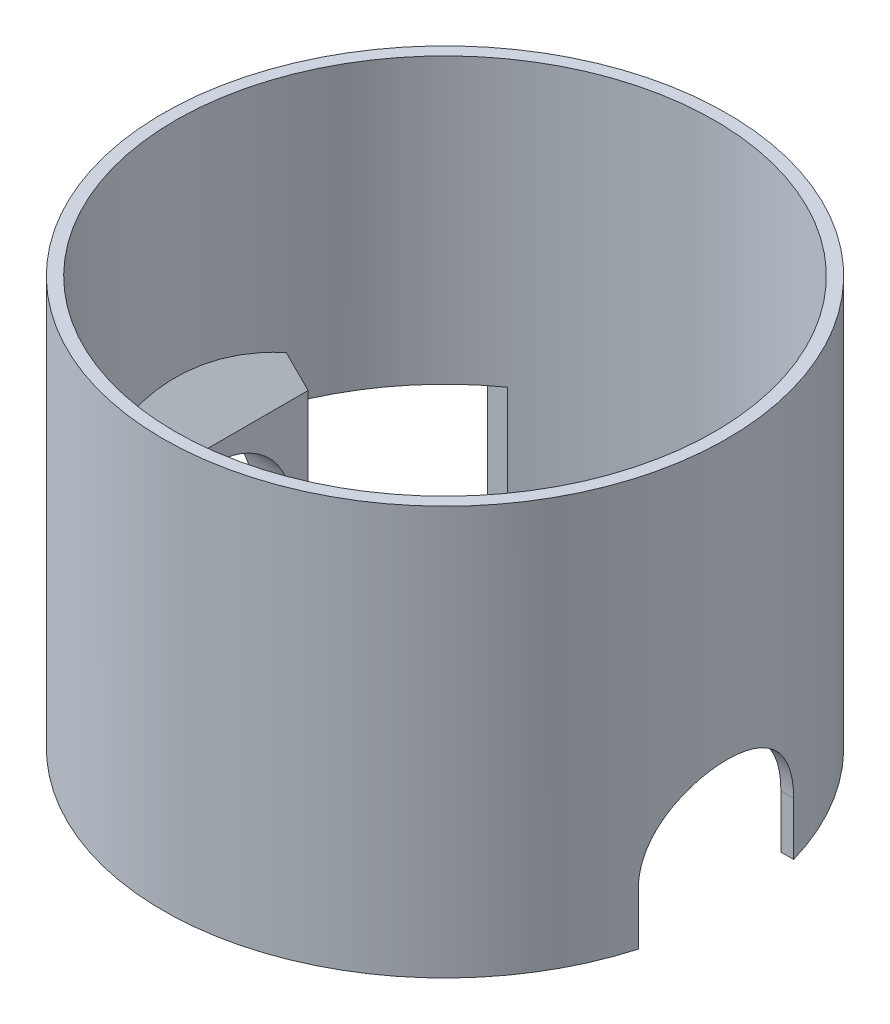
from build123d import *

# Parameters (mm, degrees)
SKETCH1_R               = 69
SKETCH1_R_2             = 66
BOSS_EXTRUDE1_DEPTH     = 100
CUT_EXTRUDE1_REACH      = 200.205
SKETCH3_W               = 20
SKETCH3_H               = 28
FILLET1_R               = 3
SKETCH4_W               = 30.4
SKETCH4_H               = 30.4
CUT_EXTRUDE2_DEPTH      = 140.721151039
CUT_EXTRUDE6_DEPTH      = 140.721151039
CUT_EXTRUDE6_DEPTH_BACK = 140.721151039
BOSS_EXTRUDE2_REACH     = 198.221
BOSS_EXTRUDE2_START     = -56.5
SKETCH8_W               = 46
SKETCH8_H               = 35
BOSS_EXTRUDE4_DEPTH     = 30
SKETCH9_OUTSIDE_W       = 207.751
SKETCH9_OUTSIDE_H       = 186.632
SKETCH9_OUTSIDE_R       = 69
CUT_EXTRUDE7_DEPTH      = 152.269287203
CUT_EXTRUDE8_DEPTH      = 140.721151039
CUT_EXTRUDE9_DEPTH      = 140.721151039


with BuildPart() as part:
    # Sketch1 → Boss-Extrude1 (new body)
    with BuildSketch(Plane(origin=(0, 0, 0), x_dir=(1, 0, 0), z_dir=(0, 1, 0))):
        Circle(SKETCH1_R)
        Circle(SKETCH1_R_2, mode=Mode.SUBTRACT)
    extrude(amount=BOSS_EXTRUDE1_DEPTH)

    # Sketch3 → Cut-Extrude1 (cut, up to next)
    with BuildSketch(Plane(origin=(-64.951905284, 0, 37.5), x_dir=(-0.5000000000000013, 0, -0.8660254037844379), z_dir=(0.8660254037844378, 0, -0.5000000000000012)), mode=Mode.PRIVATE) as cut_extrude1_sk1:
        with Locations((0, 45.5)):
            Rectangle(SKETCH3_W, SKETCH3_H)
    cut_extrude1_tool1 = extrude(cut_extrude1_sk1.sketch, amount=CUT_EXTRUDE1_REACH, mode=Mode.PRIVATE) & part.part
    add(cut_extrude1_tool1.solids().sort_by_distance((-64.951905, 45.5, 37.5))[0], mode=Mode.SUBTRACT)

    # Fillet1
    fillet1_edges = [part.edges().sort_by_distance(p)[0] for p in [
        (-52.811327716, 31.5, 42.037639657),
        (-62.811327716, 31.5, 24.717131581),
        (-52.811327716, 59.5, 42.037639657),
        (-62.811327716, 59.5, 24.717131581),
    ]]
    fillet(fillet1_edges, radius=FILLET1_R)

    # Sketch4 → Cut-Extrude2 (cut, through all)
    with BuildSketch(Plane(origin=(0, 0, 0), x_dir=(0, 0, -1), z_dir=(1, 0, 0))):
        with Locations((38.5, 15.2)):
            Rectangle(SKETCH4_W, SKETCH4_H)
    extrude(amount=-CUT_EXTRUDE2_DEPTH, mode=Mode.SUBTRACT)

    # Sketch5 → Cut-Extrude6 (cut, two sides: drawn at the far end of the back side and taken through both)
    with BuildSketch(Plane(origin=(0, 0, 0), x_dir=(0, 0, -1), z_dir=(1, 0, 0)).offset(-CUT_EXTRUDE6_DEPTH_BACK)):
        with BuildLine():
            Line((19, 13), (19, -6))
            Line((19, -6), (-19, -6))
            Line((-19, -6), (-19, 13))
            ThreePointArc((-19, 13), (0, 32), (19, 13))
        make_face()
    extrude(amount=CUT_EXTRUDE6_DEPTH + CUT_EXTRUDE6_DEPTH_BACK, mode=Mode.SUBTRACT)

    # Sketch6 → Boss-Extrude2 (add, up to next)
    with BuildSketch(Plane(origin=(0, 0, 0), x_dir=(0, 0, -1), z_dir=(1, 0, 0)).offset(BOSS_EXTRUDE2_START), mode=Mode.PRIVATE) as boss_extrude2_sk1:
        with BuildLine():
            Line((19, 13), (19, 0))
            Line((19, 0), (23, 0))
            Line((23, 0), (23, 13))
            ThreePointArc((23, 13), (0, 36), (-23, 13))
            Line((-23, 13), (-23, 0))
            Line((-23, 0), (-19, 0))
            Line((-19, 0), (-19, 13))
            ThreePointArc((-19, 13), (0, 32), (19, 13))
        make_face()
    boss_extrude2_tool1 = extrude(boss_extrude2_sk1.sketch, amount=-BOSS_EXTRUDE2_REACH, mode=Mode.PRIVATE) - part.part
    add(boss_extrude2_tool1.solids().sort_by_distance((-56.5, 6.5, 22.415877))[0])

    # Sketch8 → Boss-Extrude4 (add)
    with BuildSketch(Plane(origin=(-10.25, -10.25, 0), x_dir=(0, 0, -1), z_dir=(-0.7071067811865512, -0.7071067811865438, 0))):
        with Locations((0, -65.451533137)):
            Rectangle(SKETCH8_W, SKETCH8_H)
    extrude(amount=BOSS_EXTRUDE4_DEPTH)

    # Sketch9 outside → Cut-Extrude7 (cut, through all)
    with BuildSketch(Plane.XZ):
        with Locations((-10.5595, 0)):
            Rectangle(SKETCH9_OUTSIDE_W, SKETCH9_OUTSIDE_H)
        Circle(SKETCH9_OUTSIDE_R, mode=Mode.SUBTRACT)
    extrude(amount=-CUT_EXTRUDE7_DEPTH, mode=Mode.SUBTRACT)

    # Sketch9<3> → Cut-Extrude8 (cut, through all)
    with BuildSketch(Plane.XZ):
        with BuildLine():
            ThreePointArc((-61.750384614, -23.3), (21.162519062, -62.515180452), (63.206012372, 19))
            ThreePointArc((63.206012372, 19), (2.109760074, 65.966271021), (-61.862751313, 23))
            Line((-61.862751313, 23), (-56.5, 23))
            Line((-56.5, 23), (-56.5, 19))
            Line((-56.5, 19), (-56.5, -19))
            Line((-56.5, -19), (-56.5, -23))
            Line((-56.5, -23), (-61.862751313, -23))
            ThreePointArc((-61.862751313, -23), (-61.806749983, -23.150068176), (-61.750384614, -23.3))
        make_face()
    extrude(amount=-CUT_EXTRUDE8_DEPTH, mode=Mode.SUBTRACT)

    # Sketch5<2> → Cut-Extrude9 (cut, through all)
    with BuildSketch(Plane(origin=(0, 0, 0), x_dir=(0, 0, -1), z_dir=(1, 0, 0))):
        with BuildLine():
            Line((19, 13), (19, -6))
            Line((19, -6), (-19, -6))
            Line((-19, -6), (-19, 13))
            ThreePointArc((-19, 13), (0, 32), (19, 13))
        make_face()
    extrude(amount=-CUT_EXTRUDE9_DEPTH, mode=Mode.SUBTRACT)


solid = part.part
